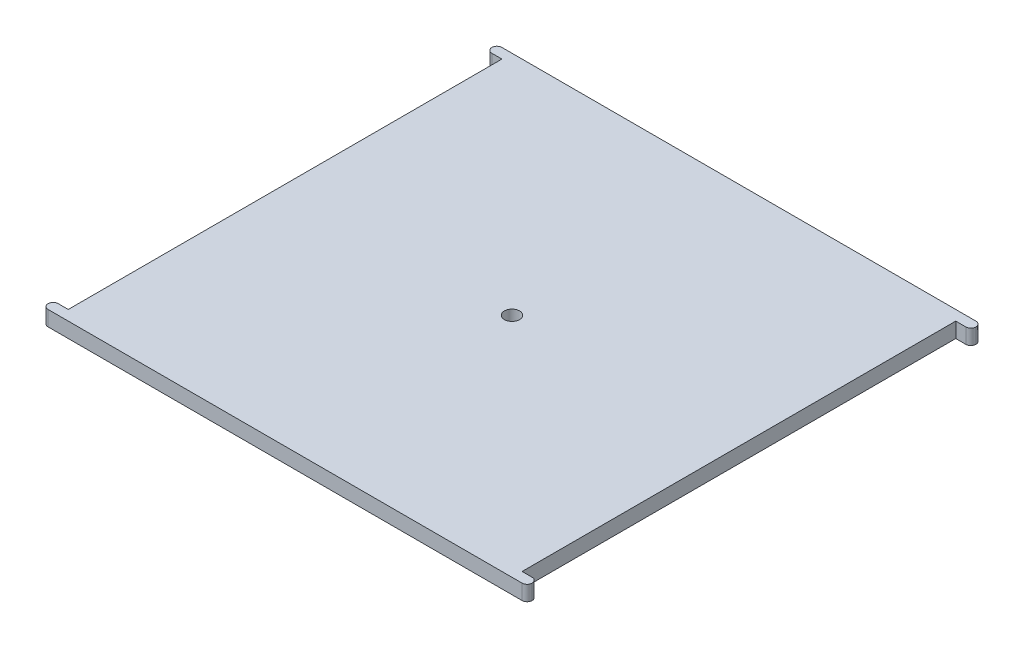
from build123d import *

# Parameters (mm, degrees)
BOSS_EXTRUDE1_DEPTH            = 4.7625
F_3_16_0_1875_DIAMETER_HOLE1_D = 4.7625
FILLET1_R                      = 1.5875


with BuildPart() as part:
    # Sketch1 → Boss-Extrude1 (new body)
    with BuildSketch(Plane(origin=(0, 0, 0), x_dir=(1, 0, 0), z_dir=(0, 1, 0))):
        Polygon((-71.4375, -71.4375), (71.4375, -71.4375), (76.2, -71.4375), (76.2, -68.2625), (71.4375, -68.2625), (71.4375, 68.2625), (76.2, 68.2625), (76.2, 71.4375), (71.4375, 71.4375), (-71.4375, 71.4375), (-76.2, 71.4375), (-76.2, 68.2625), (-71.4375, 68.2625), (-71.4375, -68.2625), (-76.2, -68.2625), (-76.2, -71.4375), align=None)
    extrude(amount=BOSS_EXTRUDE1_DEPTH)

    # 3/16 (0.1875) Diameter Hole1 (through all)
    with Locations(Plane(origin=(0, 4.7625, 0), x_dir=(1, 0, 0), z_dir=(0, 1, 0))):
        with Locations((0, 0)):
            Hole(F_3_16_0_1875_DIAMETER_HOLE1_D / 2)

    # Fillet1
    fillet1_edges = [part.edges().sort_by_distance(p)[0] for p in [
        (-76.2, 2.38125, 71.4375),
        (-76.2, 2.38125, 68.2625),
        (76.2, 2.38125, 71.4375),
        (76.2, 2.38125, 68.2625),
        (76.2, 2.38125, -68.2625),
        (76.2, 2.38125, -71.4375),
        (-76.2, 2.38125, -68.2625),
        (-76.2, 2.38125, -71.4375),
    ]]
    fillet(fillet1_edges, radius=FILLET1_R - 0.0001)  # a hair under: the kernel refuses the full size


solid = part.part
